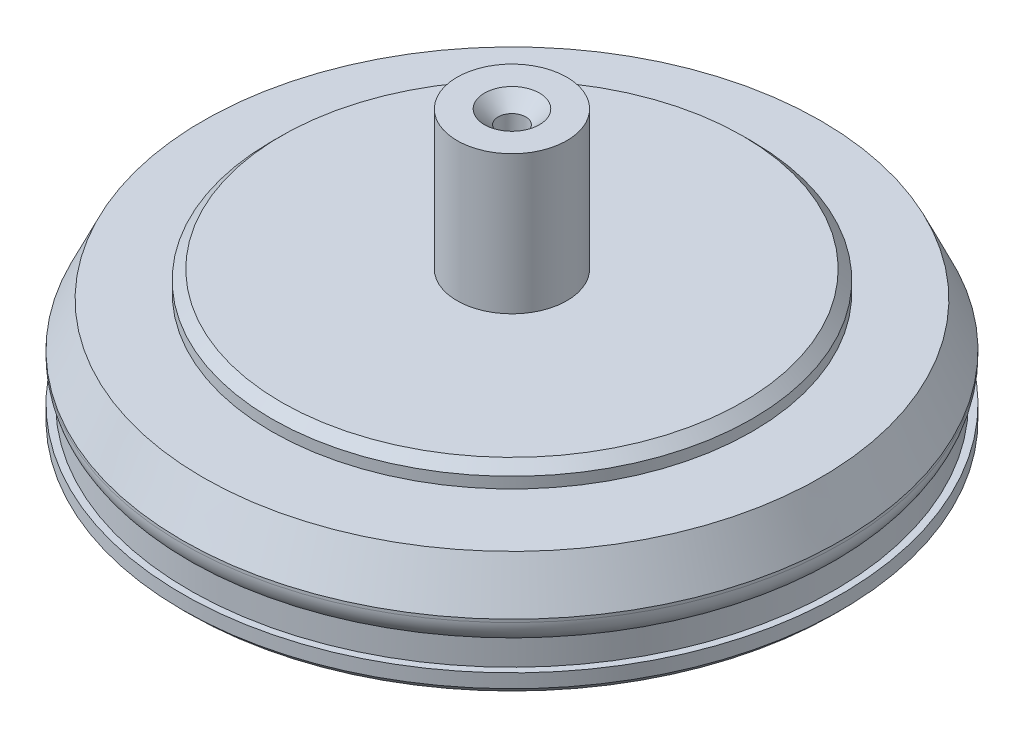
from build123d import *
from OCP.BRepFilletAPI import BRepFilletAPI_MakeChamfer

# Parameters (mm, degrees)
SKETCH1_W       = 20
SKETCH1_H       = 2.5
SKETCH1_W_2     = 13.5
SKETCH1_H_2     = 1.5
SKETCH1_W_3     = 1
SKETCH1_H_3     = 4
CHAMFER1_SIZE   = 1.5
CHAMFER1_SIZE2  = 3.216760381
CHAMFER2_SIZE   = 1.732050808
CHAMFER2_SIZE_2 = 1
FILLET6_R       = 2
CHAMFER3_SIZE   = 1
CHAMFER4_SIZE   = 0.7
SKETCH3_W       = 2
SKETCH3_H       = 1.4
SKETCH3_3_W     = 2
SKETCH3_3_H     = 1.4
SKETCH3_3_W_2   = 0.7
SKETCH3_3_H_2   = 2
REVOLVE3_ANGLE  = 355
CHAMFER5_SIZE   = 0.5


# Some blends are built 0.0001 mm under size
with BuildPart() as part:
    # Sketch1 → Revolve1 (revolve)
    with BuildSketch(Plane.XY, mode=Mode.PRIVATE) as revolve1_sk:
        with BuildLine():
            ThreePointArc((-20, 2.5), (-20.35, 2.85), (-20, 3.2))
            Line((-20, 3.2), (-20, 6.2))
            Line((-20, 6.2), (-24, 6.2))
            Line((-24, 6.2), (-24, 0))
            Line((-24, 0), (-20, 0))
            Line((-20, 0), (-20, 2.5))
        make_face()
        with BuildLine():
            Line((-20, 6.2), (-20, 3.2))
            add(Edge.make_bspline(
                [(-20, 3.2), (-17.980801876, 2.682507767), (-14.91231446, 2.835315185), (-10.877832782, 3.989364254), (-6.922969843, 2.860615153), (-3.936379553, 2.67369733), (-2, 3.2)],
                knots=[0, 0, 0, 0, 0.33680166, 0.506831372, 0.676362633, 1, 1, 1, 1], degree=3))
            Line((-2, 3.2), (-2, 6.2))
            Line((-2, 6.2), (-4, 6.2))
            Line((-4, 6.2), (-20, 6.2))
        make_face()
        with Locations((-10, 1.25)):
            Rectangle(SKETCH1_W, SKETCH1_H)
        Polygon((-4, 6.6), (-4, 6.2), (-2, 6.2), (-2, 14.2), (-2, 18.2), (-4, 18.2), (-4, 8.1), align=None)
        with Locations((-10.75, 7.35)):
            Rectangle(SKETCH1_W_2, SKETCH1_H_2)
        with Locations((-1.5, 16.2)):
            Rectangle(SKETCH1_W_3, SKETCH1_H_3)
    revolve(revolve1_sk.sketch.rotate(Axis((0, 0, 0), (0, 1, 0)), 270), axis=Axis((0, 0, 0), (0, 1, 0)))

    # Chamfer1: one chamfer whose edges measure the first distance from different faces: ONE call of the kernel's chamfer builder (chamfer() names one face for all edges)
    chamfer1_edges_1 = [part.edges().sort_by_distance(p)[0] for p in [
        (0, 0, 24),
    ]]
    chamfer1_side_1 = [part.faces().sort_by_distance(p)[0] for p in [
        (0, 3.1, 24),
    ]]
    chamfer1_edges_2 = [part.edges().sort_by_distance(p)[0] for p in [
        (0, 6.2, 24),
    ]]
    chamfer1_side_2 = [part.faces().sort_by_distance(p)[0] for p in [
        (0, 6.2, 23.32117749),
    ]]
    chamfer1 = BRepFilletAPI_MakeChamfer(part.part.solid().wrapped)
    for e in chamfer1_edges_1:
        chamfer1.Add(CHAMFER1_SIZE, CHAMFER1_SIZE2, e.wrapped, chamfer1_side_1[0].wrapped)  # the first distance lies on this face
    for e in chamfer1_edges_2:
        chamfer1.Add(CHAMFER1_SIZE, CHAMFER1_SIZE2, e.wrapped, chamfer1_side_2[0].wrapped)  # the first distance lies on this face
    add(Compound.cast(chamfer1.Shape()), mode=Mode.REPLACE)

    # Chamfer2
    # the kernel refuses this chamfer: 1.732050808, 1 mm, written as the material it adds along each edge
    with BuildSketch(Plane(origin=(0, 6.2, 0), x_dir=(0, 0, -1), z_dir=(1, 0, 0))) as chamfer2_piece_1:
        Polygon((4 + CHAMFER2_SIZE, 0), (4, CHAMFER2_SIZE_2), (4, 0), align=None)
    revolve(axis=Axis((0, 6.2, 0), (0, 1, 0)))

    # Fillet6
    fillet6_edges = [part.edges().sort_by_distance(p)[0] for p in [
        (0, 1.5, 24),
    ]]
    fillet(fillet6_edges, radius=FILLET6_R)

    # Chamfer3
    chamfer3_edges = [part.edges().sort_by_distance(p)[0] for p in [
        (0, 18.2, 1),
        (0, 14.2, 2),
    ]]
    chamfer(chamfer3_edges, length=CHAMFER3_SIZE - 0.0001)  # a hair under: the kernel refuses the full size

    # Chamfer4
    chamfer4_edges = [part.edges().sort_by_distance(p)[0] for p in [
        (0, 8.1, 17.5),
    ]]
    chamfer(chamfer4_edges, length=CHAMFER4_SIZE)

    # Sketch3 → Revolve2 (revolve)
    with BuildSketch(Plane.XY, mode=Mode.PRIVATE) as revolve2_sk:
        Polygon((0, 1), (0, -1.9), (-2, -1.9), (-2, -0.4), (-2, 1), align=None)
        with Locations((-3, 0.3)):
            Rectangle(SKETCH3_W, SKETCH3_H)
        Polygon((-2, -1.9), (-2, -0.4), (-4, -0.4), (-22.8, -0.4), (-23.5, -0.4), (-24, -0.4), (-24, -1.9), align=None)
    revolve(revolve2_sk.sketch.rotate(Axis((0, 0, 0), (0, 1, 0)), 270), axis=Axis((0, 0, 0), (0, 1, 0)))

    # Sketch3<3> → Revolve3 (revolve)
    with BuildSketch(Plane.XY):
        with Locations((-3, 0.3)):
            Rectangle(SKETCH3_3_W, SKETCH3_3_H)
        Polygon((0, 1), (-2, 1), (-2, -0.4), (-2, -1.9), (0, -1.9), align=None)
        Polygon((-2, -1.9), (-2, -0.4), (-4, -0.4), (-22.8, -0.4), (-23.5, -0.4), (-24, -0.4), (-24, -1.9), align=None)
        with Locations((-23.15, 0.6)):
            Rectangle(SKETCH3_3_W_2, SKETCH3_3_H_2)
    revolve(axis=Axis((0, 1, 0), (0, -1, 0)), revolution_arc=REVOLVE3_ANGLE)

    # Chamfer5
    chamfer5_edges = [part.edges().sort_by_distance(p)[0] for p in [
        (0, -1.9, 24),
    ]]
    chamfer(chamfer5_edges, length=CHAMFER5_SIZE)


solid = part.part
